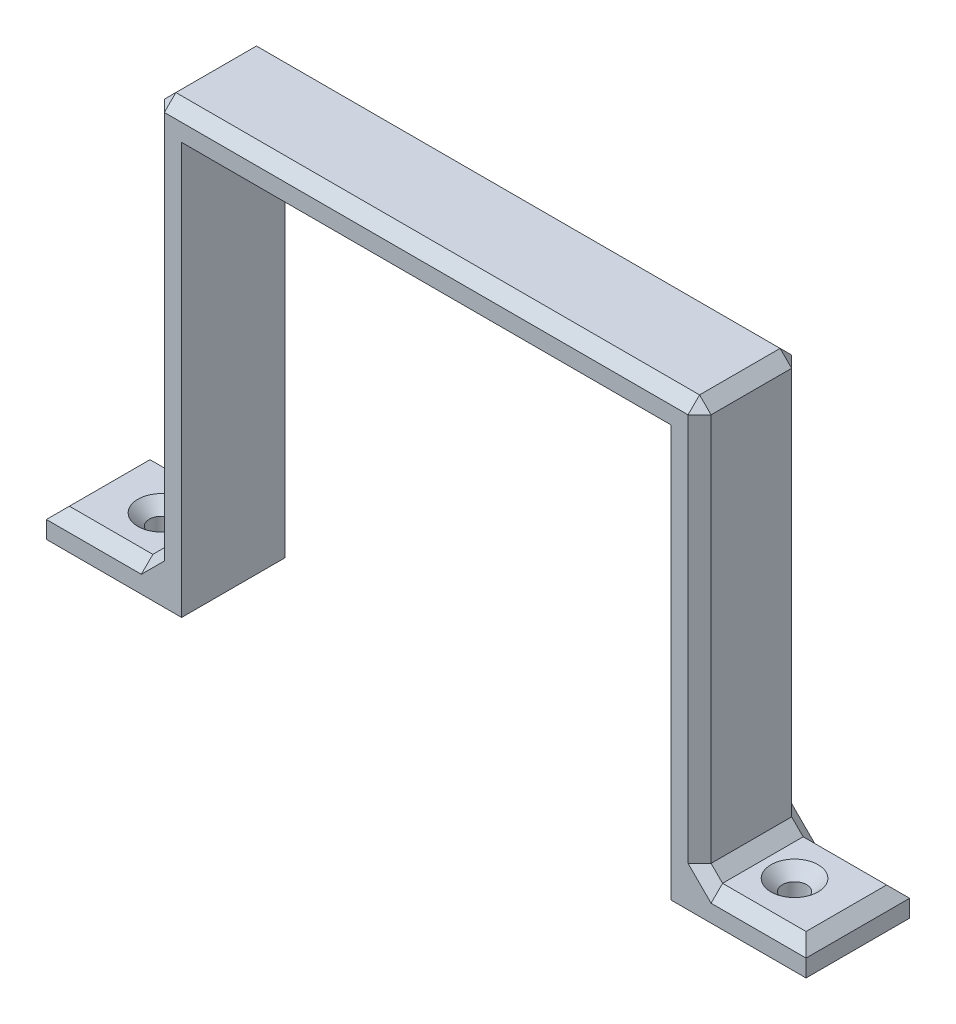
from build123d import *

# Parameters (mm, degrees)
BOSS_EXTRUDE1_DEPTH = 9
SKETCH2_R           = 2.1
CUT_EXTRUDE1_DEPTH  = 9
CHAMFER1_SIZE       = 2
CHAMFER2_SIZE       = 2


with BuildPart() as part:
    # Sketch1 → Boss-Extrude1 (new, symmetric)
    with BuildSketch(Plane.XY):
        Polygon((42.5, -27.85), (42.5, 43.65), (-42.5, 43.65), (-42.5, -27.85), (-66, -27.85), (-66, -22.85), (-47.5, -22.85), (-47.5, 48.65), (47.5, 48.65), (47.5, -22.85), (66, -22.85), (66, -27.85), align=None)
    extrude(amount=BOSS_EXTRUDE1_DEPTH, both=True)

    # Sketch2 → Cut-Extrude1 (cut, symmetric)
    with BuildSketch(Plane.XZ.offset(27.85)):
        with Locations((55, 0)):
            Circle(SKETCH2_R)
        with Locations((-55, 0)):
            Circle(SKETCH2_R)
    extrude(amount=CUT_EXTRUDE1_DEPTH, both=True, mode=Mode.SUBTRACT)

    # Chamfer1
    chamfer1_edges = [part.edges().sort_by_distance(p)[0] for p in [
        (-57.1, -22.85, 0),
        (52.9, -22.85, 0),
    ]]
    chamfer(chamfer1_edges, length=CHAMFER1_SIZE)

    # Chamfer2
    chamfer2_edges = [part.edges().sort_by_distance(p)[0] for p in [
        (56.75, -22.85, 9),
        (56.75, -22.85, -9),
        (-56.75, -22.85, 9),
        (-66, -22.85, 0),
        (-56.75, -22.85, -9),
        (-47.5, 12.9, 9),
        (-47.5, -22.85, 0),
        (-47.5, 12.9, -9),
        (47.5, -22.85, 0),
        (47.5, 12.9, 9),
        (47.5, 12.9, -9),
        (47.5, 48.65, 0),
        (0, 48.65, 9),
        (-47.5, 48.65, 0),
        (0, 48.65, -9),
        (66, -22.85, 0),
    ]]
    chamfer(chamfer2_edges, length=CHAMFER2_SIZE)


solid = part.part
